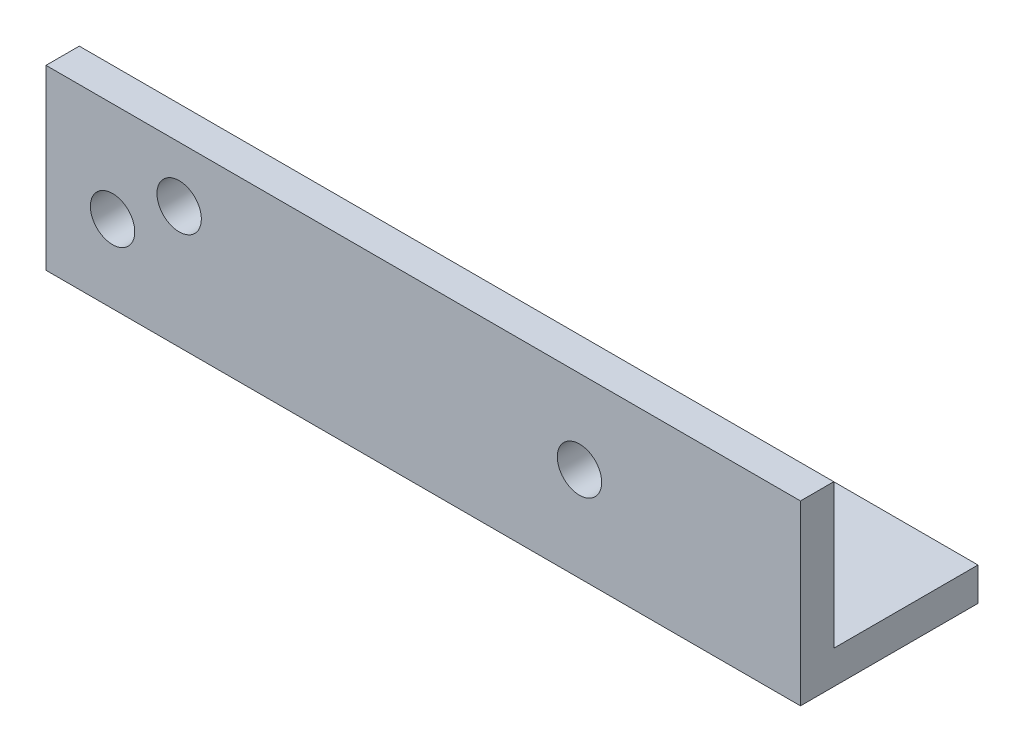
from build123d import *

# Parameters (mm, degrees)
BOSS_EXTRUDE1_DEPTH = 107.95
CUT_EXTRUDE1_REACH  = 114.802
SKETCH3_R           = 3.175
CUT_EXTRUDE2_REACH  = 115.77
SKETCH4_R           = 3.175
CUT_EXTRUDE4_REACH  = 115.77
SKETCH5_R           = 3.175


with BuildPart() as part:
    # Sketch1 → Boss-Extrude1 (new body)
    with BuildSketch(Plane(origin=(0, 0, 0), x_dir=(0, 0, -1), z_dir=(1, 0, 0))):
        Polygon((0, 0), (0, -25.4), (25.4, -25.4), (25.4, -20.6375), (4.7625, -20.6375), (4.7625, 0), align=None)
    extrude(amount=BOSS_EXTRUDE1_DEPTH)

    # Sketch3 → Cut-Extrude1 (cut, up to next)
    with BuildSketch(Plane(origin=(0, 0, -4.7625), x_dir=(-1, 0, 0), z_dir=(0, 0, -1)), mode=Mode.PRIVATE) as cut_extrude1_sk1:
        with Locations((-9.525, -14.2875)):
            Circle(SKETCH3_R)
    cut_extrude1_tool1 = extrude(cut_extrude1_sk1.sketch, amount=-CUT_EXTRUDE1_REACH, mode=Mode.PRIVATE) & part.part
    # Sketch3 → Cut-Extrude1 (cut, up to next)
    with BuildSketch(Plane(origin=(0, 0, -4.7625), x_dir=(-1, 0, 0), z_dir=(0, 0, -1)), mode=Mode.PRIVATE) as cut_extrude1_sk2:
        with Locations((-19.05, -7.9375)):
            Circle(SKETCH3_R)
    cut_extrude1_tool2 = extrude(cut_extrude1_sk2.sketch, amount=-CUT_EXTRUDE1_REACH, mode=Mode.PRIVATE) & part.part
    add(cut_extrude1_tool1.solids().sort_by_distance((9.525, -14.2875, -4.7625))[0], mode=Mode.SUBTRACT)
    add(cut_extrude1_tool2.solids().sort_by_distance((19.05, -7.9375, -4.7625))[0], mode=Mode.SUBTRACT)

    # Sketch4 → Cut-Extrude2 (cut, up to next)
    with BuildSketch(Plane.XY, mode=Mode.PRIVATE) as cut_extrude2_sk1:
        with Locations((76.332177029, -11.929615818)):
            Circle(SKETCH4_R)
    cut_extrude2_tool1 = extrude(cut_extrude2_sk1.sketch, amount=-CUT_EXTRUDE2_REACH, mode=Mode.PRIVATE) & part.part
    add(cut_extrude2_tool1.solids().sort_by_distance((76.332177, -11.929616, 0))[0], mode=Mode.SUBTRACT)

    # Sketch5 → Cut-Extrude4 (cut, up to next)
    with BuildSketch(Plane.XZ.offset(25.4), mode=Mode.PRIVATE) as cut_extrude4_sk1:
        with Locations((69.85, -12.7)):
            Circle(SKETCH5_R)
    cut_extrude4_tool1 = extrude(cut_extrude4_sk1.sketch, amount=-CUT_EXTRUDE4_REACH, mode=Mode.PRIVATE) & part.part
    # Sketch5 → Cut-Extrude4 (cut, up to next)
    with BuildSketch(Plane.XZ.offset(25.4), mode=Mode.PRIVATE) as cut_extrude4_sk2:
        with Locations((95.25, -12.7)):
            Circle(SKETCH5_R)
    cut_extrude4_tool2 = extrude(cut_extrude4_sk2.sketch, amount=-CUT_EXTRUDE4_REACH, mode=Mode.PRIVATE) & part.part
    add(cut_extrude4_tool1.solids().sort_by_distance((69.85, -25.4, -12.7))[0], mode=Mode.SUBTRACT)
    add(cut_extrude4_tool2.solids().sort_by_distance((95.25, -25.4, -12.7))[0], mode=Mode.SUBTRACT)


solid = part.part
